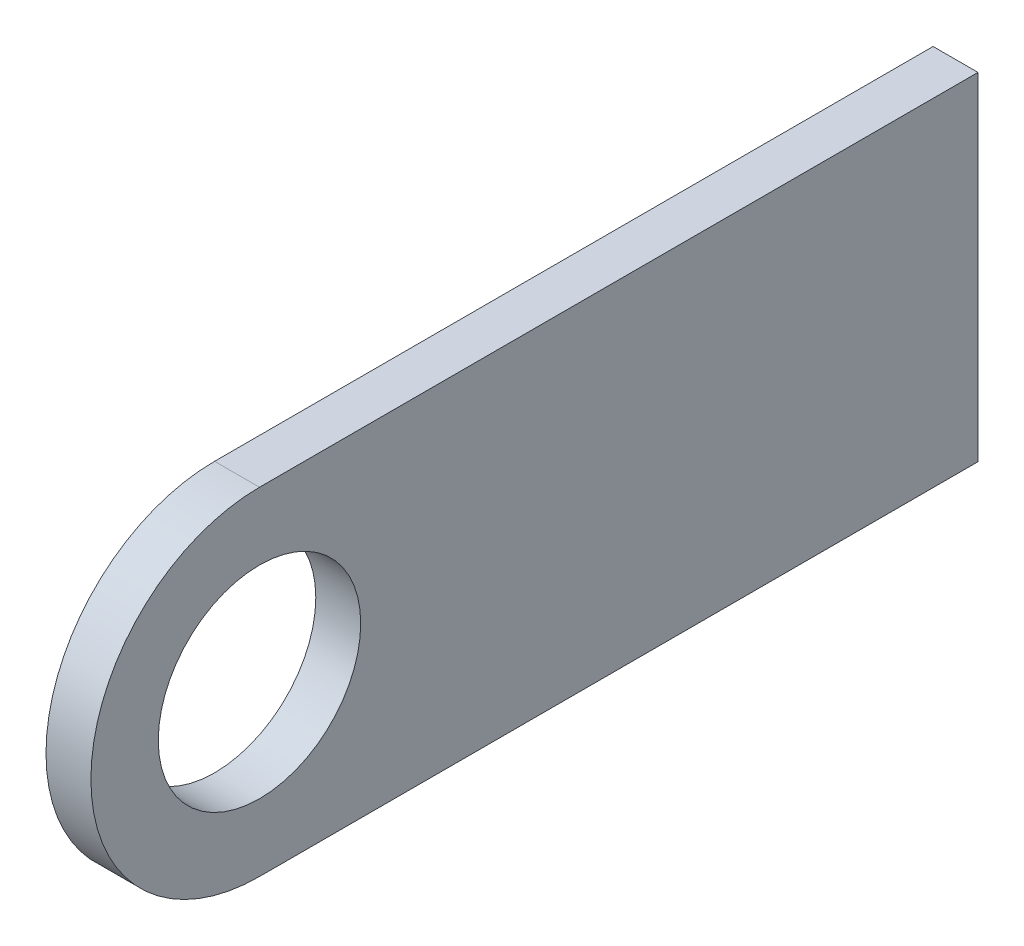
from build123d import *

# Parameters (mm, degrees)
SKETCH1_R           = 14.3129
BOSS_EXTRUDE1_DEPTH = 6.35


with BuildPart() as part:
    # Sketch1 → Boss-Extrude1 (new body)
    with BuildSketch(Plane(origin=(0, 0, 0), x_dir=(0, 0, -1), z_dir=(1, 0, 0))):
        with BuildLine():
            Line((0, -23.8379), (0, 23.8379))
            Line((0, 23.8379), (-101.6, 23.8379))
            ThreePointArc((-101.6, 23.8379), (-125.4379, 0), (-101.6, -23.8379))
            Line((-101.6, -23.8379), (0, -23.8379))
        make_face()
        with Locations((-101.6, 0)):
            Circle(SKETCH1_R, mode=Mode.SUBTRACT)
    extrude(amount=BOSS_EXTRUDE1_DEPTH)


solid = part.part
